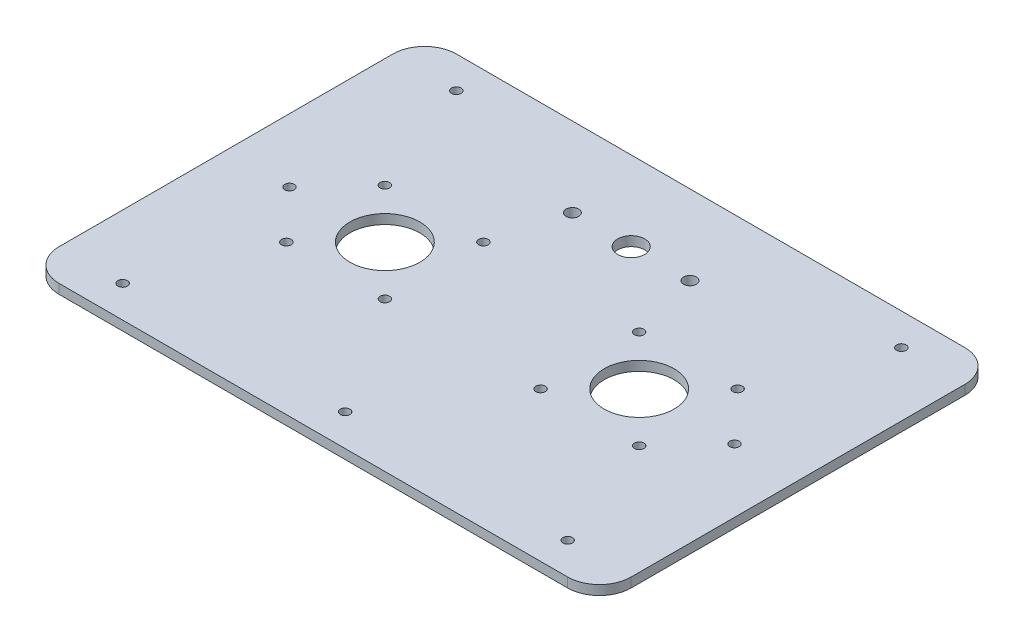
from build123d import *

# Parameters (mm, degrees)
SKETCH_1_R             = 1.5
SKETCH_1_R_2           = 4.25
SKETCH_1_R_3           = 2
SKETCH_1_R_4           = 11
SM_BASE_FLANGE_1_DEPTH = 3


# Sheet-metal steps are written as plain solids
with BuildPart() as part:
    # Sketch 1 → 基体-法兰1 (new body)
    with BuildSketch(Plane(origin=(0, 0, 0), x_dir=(1, 0, 0), z_dir=(0, 1, 0))):
        with BuildLine():
            Line((-80, 62.5), (80, 62.5))
            ThreePointArc((80, 62.5), (87.071067812, 59.571067812), (90, 52.5))
            Line((90, 52.5), (90, -52.5))
            ThreePointArc((90, -52.5), (87.071067812, -59.571067812), (80, -62.5))
            Line((80, -62.5), (-80, -62.5))
            ThreePointArc((-80, -62.5), (-87.071067812, -59.571067812), (-90, -52.5))
            Line((-90, -52.5), (-90, 52.5))
            ThreePointArc((-90, 52.5), (-87.071067812, 59.571067812), (-80, 62.5))
        make_face()
        with Locations(Location((-70, 52.5, 0), (0, 0, 270))):
            Circle(SKETCH_1_R, mode=Mode.SUBTRACT)
        with Locations(Location((-70, 0, 0), (0, 0, 270))):
            Circle(SKETCH_1_R, mode=Mode.SUBTRACT)
        with Locations(Location((-70, -52.5, 0), (0, 0, 270))):
            Circle(SKETCH_1_R, mode=Mode.SUBTRACT)
        with Locations(Location((0, -52.5, 0), (0, 0, 270))):
            Circle(SKETCH_1_R, mode=Mode.SUBTRACT)
        with Locations(Location((70, -52.5, 0), (0, 0, 270))):
            Circle(SKETCH_1_R, mode=Mode.SUBTRACT)
        with Locations(Location((70, 0, 0), (0, 0, 270))):
            Circle(SKETCH_1_R, mode=Mode.SUBTRACT)
        with Locations(Location((70, 52.5, 0), (0, 0, 270))):
            Circle(SKETCH_1_R, mode=Mode.SUBTRACT)
        with Locations(Location((0, 37.5, 0), (0, 0, 270))):
            Circle(SKETCH_1_R_2, mode=Mode.SUBTRACT)
        with Locations(Location((-18.5, 37.5, 0), (0, 0, 270))):
            Circle(SKETCH_1_R_3, mode=Mode.SUBTRACT)
        with Locations(Location((18.5, 37.5, 0), (0, 0, 270))):
            Circle(SKETCH_1_R_3, mode=Mode.SUBTRACT)
        with Locations(Location((40, 0, 0), (0, 0, 270))):
            Circle(SKETCH_1_R_4, mode=Mode.SUBTRACT)
        with Locations(Location((-40, 0, 0), (0, 0, 270))):
            Circle(SKETCH_1_R_4, mode=Mode.SUBTRACT)
        with Locations(Location((55.5, 15.5, 0), (0, 0, 270))):
            Circle(SKETCH_1_R, mode=Mode.SUBTRACT)
        with Locations(Location((55.5, -15.5, 0), (0, 0, 270))):
            Circle(SKETCH_1_R, mode=Mode.SUBTRACT)
        with Locations(Location((24.5, -15.5, 0), (0, 0, 270))):
            Circle(SKETCH_1_R, mode=Mode.SUBTRACT)
        with Locations(Location((24.5, 15.5, 0), (0, 0, 270))):
            Circle(SKETCH_1_R, mode=Mode.SUBTRACT)
        with Locations(Location((-24.5, 15.5, 0), (0, 0, 270))):
            Circle(SKETCH_1_R, mode=Mode.SUBTRACT)
        with Locations(Location((-24.5, -15.5, 0), (0, 0, 270))):
            Circle(SKETCH_1_R, mode=Mode.SUBTRACT)
        with Locations(Location((-55.5, -15.5, 0), (0, 0, 270))):
            Circle(SKETCH_1_R, mode=Mode.SUBTRACT)
        with Locations(Location((-55.5, 15.5, 0), (0, 0, 270))):
            Circle(SKETCH_1_R, mode=Mode.SUBTRACT)
    extrude(amount=-SM_BASE_FLANGE_1_DEPTH)


solid = part.part
